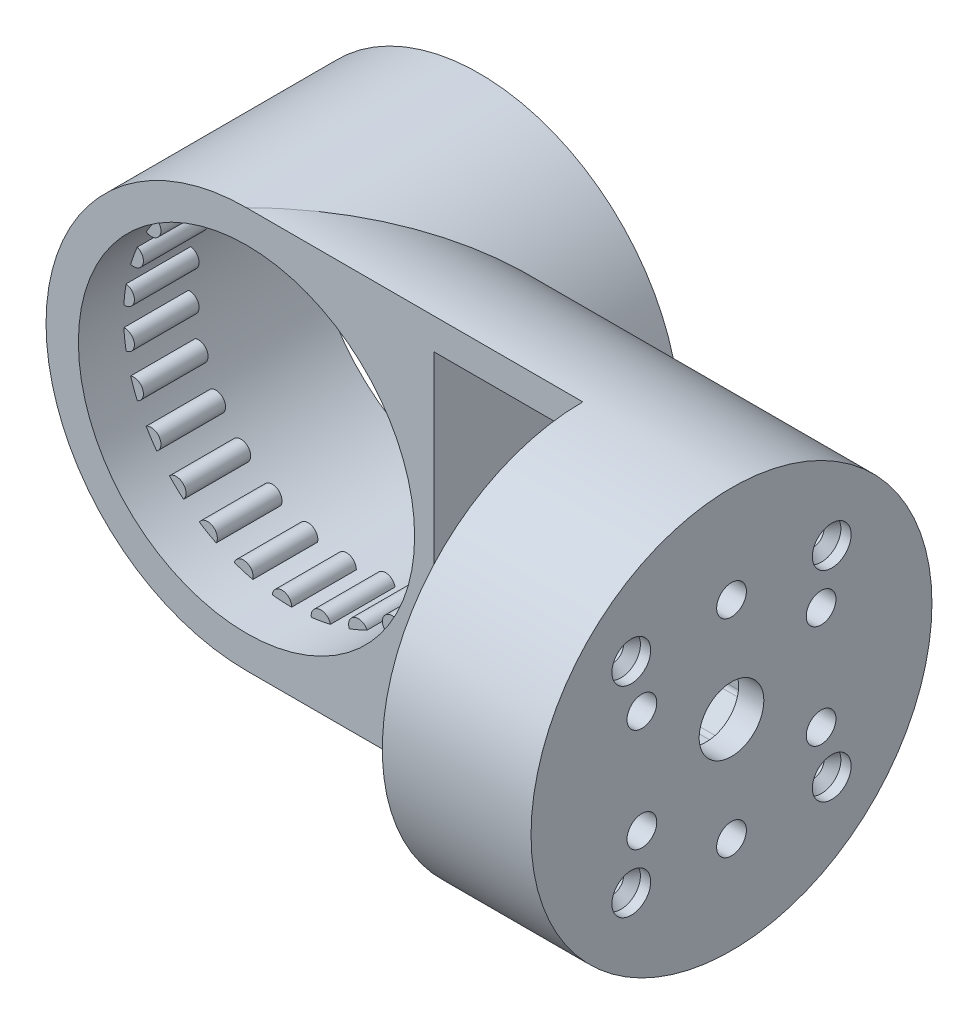
from build123d import *
from build123d.topology import SkipClean

# Parameters (mm, degrees)
SKETCH3_R                = 31
SKETCH3_R_2              = 26
BOSS_EXTRUDE1_DEPTH      = 7
SKETCH4_R                = 31
SKETCH4_R_2              = 26
BOSS_EXTRUDE2_DEPTH      = 10
SKETCH5_R                = 1.5
BOSS_EXTRUDE3_DEPTH      = 10
SKETCH7_R                = 31
SKETCH7_R_2              = 26
BOSS_EXTRUDE4_DEPTH      = 7
BOSS_EXTRUDE5_START      = 12
SKETCH33_R               = 31
SKETCH33_R_2             = 26
BOSS_EXTRUDE5_DEPTH      = 12
BOSS_EXTRUDE6_REACH      = 114.427
BOSS_EXTRUDE6_END_RADIUS = 31
BOSS_EXTRUDE7_DEPTH      = 23
CUT_EXTRUDE1_DEPTH       = 23
CUT_EXTRUDE2_START       = 23
CUT_EXTRUDE2_DEPTH       = 23
SKETCH42_R               = 31
BOSS_EXTRUDE8_DEPTH      = 6
SKETCH40_R               = 11
CUT_EXTRUDE3_DEPTH       = 2.1
CUT_EXTRUDE4_REACH       = 124.087
SKETCH39_R               = 5
SKETCH39_R_2             = 2.3
SKETCH39_R_3             = 3
CIRPATTERN1_COUNT        = 4


with BuildPart() as part:
    # Sketch3 → Boss-Extrude1 (new body)
    with BuildSketch(Plane.XY.offset(-2.959079422)):
        Circle(SKETCH3_R)
        Circle(SKETCH3_R_2, mode=Mode.SUBTRACT)
    extrude(amount=BOSS_EXTRUDE1_DEPTH)

    # Sketch4 → Boss-Extrude2 (add)
    with BuildSketch(Plane.XY.offset(4.040920578)):
        Circle(SKETCH4_R)
        Circle(SKETCH4_R_2, mode=Mode.SUBTRACT)
    extrude(amount=BOSS_EXTRUDE2_DEPTH)

    # Sketch5 → Boss-Extrude3 (add)
    with BuildSketch(Plane.XY.offset(4.051320578)):
        with Locations((26, 0)):
            Circle(SKETCH5_R)
        with Locations((25.299166635, -5.996012639)):
            Circle(SKETCH5_R)
        with Locations((23.234448648, -11.668778685)):
            Circle(SKETCH5_R)
        with Locations((19.917155521, -16.712477852)):
            Circle(SKETCH5_R)
        with Locations((15.526123384, -20.855203012)):
            Circle(SKETCH5_R)
        with Locations((10.298073917, -23.873618779)):
            Circle(SKETCH5_R)
        with Locations((4.514852619, -25.605001578)):
            Circle(SKETCH5_R)
        with Locations((-1.511765552, -25.956012115)):
            Circle(SKETCH5_R)
        with Locations((-7.45688405, -24.90772732)):
            Circle(SKETCH5_R)
        with Locations((-13, -22.516660498)):
            Circle(SKETCH5_R)
        with Locations((-17.842282585, -18.911714681)):
            Circle(SKETCH5_R)
        with Locations((-21.722683097, -14.28723343)):
            Circle(SKETCH5_R)
        with Locations((-24.43200814, -8.892523726)):
            Circle(SKETCH5_R)
        with Locations((-25.824197301, -3.018415767)):
            Circle(SKETCH5_R)
        with Locations((-25.824197301, 3.018415767)):
            Circle(SKETCH5_R)
        with Locations((-24.43200814, 8.892523726)):
            Circle(SKETCH5_R)
        with Locations((-21.722683097, 14.28723343)):
            Circle(SKETCH5_R)
        with Locations((-17.842282585, 18.911714681)):
            Circle(SKETCH5_R)
        with Locations((-13, 22.516660498)):
            Circle(SKETCH5_R)
        with Locations((-7.45688405, 24.90772732)):
            Circle(SKETCH5_R)
        with Locations((-1.511765552, 25.956012115)):
            Circle(SKETCH5_R)
        with Locations((4.514852619, 25.605001578)):
            Circle(SKETCH5_R)
        with Locations((10.298073917, 23.873618779)):
            Circle(SKETCH5_R)
        with Locations((15.526123384, 20.855203012)):
            Circle(SKETCH5_R)
        with Locations((19.917155521, 16.712477852)):
            Circle(SKETCH5_R)
        with Locations((23.234448648, 11.668778685)):
            Circle(SKETCH5_R)
        with Locations((25.299166635, 5.996012639)):
            Circle(SKETCH5_R)
    extrude(amount=BOSS_EXTRUDE3_DEPTH)

    # Sketch7 → Boss-Extrude4 (add)
    with BuildSketch(Plane.XY.offset(14.040920578)):
        Circle(SKETCH7_R)
        Circle(SKETCH7_R_2, mode=Mode.SUBTRACT)
    extrude(amount=BOSS_EXTRUDE4_DEPTH)

    # Sketch33 → Boss-Extrude5 (add)
    with SkipClean():  # the faces are left unmerged after this step: merging them gives an invalid solid
        with BuildSketch(Plane(origin=(0, 0, -2.959079422), x_dir=(-1, 0, 0), z_dir=(0, 0, -1)).offset(BOSS_EXTRUDE5_START)):
            Circle(SKETCH33_R)
            Circle(SKETCH33_R_2, mode=Mode.SUBTRACT)
        extrude(amount=-BOSS_EXTRUDE5_DEPTH)

    # Boss-Extrude6: up to this cylinder (the profile starts outside it)
    with SkipClean():  # the faces are left unmerged after this step: merging them gives an invalid solid
        boss_extrude6_end = Plane(origin=(0, 0, 7.884112), z_dir=(0, 0, -1)) * Cylinder(BOSS_EXTRUDE6_END_RADIUS, 291.854, mode=Mode.PRIVATE)
        # Sketch34 → Boss-Extrude6 (add, up to the surface)
        with BuildSketch(Plane(origin=(75, 0, 0), x_dir=(0, 0, -1), z_dir=(1, 0, 0)), mode=Mode.PRIVATE) as boss_extrude6_sk1:
            with BuildLine():
                Line((-21.040920578, 31), (-21.040920578, -31))
                ThreePointArc((-21.040920578, -31), (9.959079422, 0), (-21.040920578, 31))
            make_face()
        boss_extrude6_tool1 = extrude(boss_extrude6_sk1.sketch, amount=-BOSS_EXTRUDE6_REACH, mode=Mode.PRIVATE) - boss_extrude6_end
        add(boss_extrude6_tool1.solids().sort_by_distance((75, 0, 7.884112))[0])

    # Sketch35 → Boss-Extrude7 (add)
    with SkipClean():  # the faces are left unmerged after this step: merging them gives an invalid solid
        with BuildSketch(Plane(origin=(75, 0, 0), x_dir=(0, 0, -1), z_dir=(1, 0, 0))):
            with BuildLine():
                Line((-21.040920578, 31), (-21.040920578, -31))
                ThreePointArc((-21.040920578, -31), (-52.040920578, 0), (-21.040920578, 31))
            make_face()
        extrude(amount=-BOSS_EXTRUDE7_DEPTH)
    add(part.part.scale(1), mode=Mode.REPLACE)  # the faces are merged on a copy

    # Sketch37 → Cut-Extrude1 (cut)
    with BuildSketch(Plane.ZY.offset(-52)):
        with BuildLine():
            Line((37.789247723, 21.2058), (36.42773462, 21.2058))
            ThreePointArc((36.42773462, 21.2058), (21.040920578, 26.2), (5.654106536, 21.2058))
            Line((5.654106536, 21.2058), (4.292593433, 21.2058))
            ThreePointArc((4.292593433, 21.2058), (3.906159703, 21.128933552), (3.578557006, 20.910036428))
            Line((3.578557006, 20.910036428), (0.13088415, 17.462363572))
            ThreePointArc((0.13088415, 17.462363572), (-0.088012974, 17.134760875), (-0.164879422, 16.748327145))
            Line((-0.164879422, 16.748327145), (-0.164879422, 15.386814042))
            ThreePointArc((-0.164879422, 15.386814042), (-5.159079422, 0), (-0.164879422, -15.386814042))
            Line((-0.164879422, -15.386814042), (-0.164879422, -16.748327145))
            ThreePointArc((-0.164879422, -16.748327145), (-0.088012974, -17.134760875), (0.13088415, -17.462363572))
            Line((0.13088415, -17.462363572), (3.578557006, -20.910036428))
            ThreePointArc((3.578557006, -20.910036428), (3.906159703, -21.128933552), (4.292593433, -21.2058))
            Line((4.292593433, -21.2058), (5.654106536, -21.2058))
            ThreePointArc((5.654106536, -21.2058), (21.040920578, -26.2), (36.42773462, -21.2058))
            Line((36.42773462, -21.2058), (37.789247723, -21.2058))
            ThreePointArc((37.789247723, -21.2058), (38.175681453, -21.128933552), (38.50328415, -20.910036428))
            Line((38.50328415, -20.910036428), (41.950957006, -17.462363572))
            ThreePointArc((41.950957006, -17.462363572), (42.16985413, -17.134760875), (42.246720578, -16.748327145))
            Line((42.246720578, -16.748327145), (42.246720578, -15.386814042))
            ThreePointArc((42.246720578, -15.386814042), (47.240920578, 0), (42.246720578, 15.386814042))
            Line((42.246720578, 15.386814042), (42.246720578, 16.748327145))
            ThreePointArc((42.246720578, 16.748327145), (42.16985413, 17.134760875), (41.950957006, 17.462363572))
            Line((41.950957006, 17.462363572), (38.50328415, 20.910036428))
            ThreePointArc((38.50328415, 20.910036428), (38.175681453, 21.128933552), (37.789247723, 21.2058))
        make_face()
    extrude(amount=-CUT_EXTRUDE1_DEPTH, mode=Mode.SUBTRACT)

    # Sketch38 → Cut-Extrude2 (cut)
    with BuildSketch(Plane.ZY.offset(-52).offset(CUT_EXTRUDE2_START)):
        with BuildLine():
            Line((21.040920578, 26.2), (21.040920578, -26.2))
            ThreePointArc((21.040920578, -26.2), (12.952408972, -24.920192214), (5.654106536, -21.2058))
            Line((5.654106536, -21.2058), (4.292593433, -21.2058))
            ThreePointArc((4.292593433, -21.2058), (3.906159703, -21.128933552), (3.578557006, -20.910036428))
            Line((3.578557006, -20.910036428), (0.13088415, -17.462363572))
            ThreePointArc((0.13088415, -17.462363572), (-0.088012974, -17.134760875), (-0.164879422, -16.748327145))
            Line((-0.164879422, -16.748327145), (-0.164879422, -15.386814042))
            ThreePointArc((-0.164879422, -15.386814042), (-5.159079422, 0), (-0.164879422, 15.386814042))
            Line((-0.164879422, 15.386814042), (-0.164879422, 16.748327145))
            ThreePointArc((-0.164879422, 16.748327145), (-0.088012974, 17.134760875), (0.13088415, 17.462363572))
            Line((0.13088415, 17.462363572), (3.578557006, 20.910036428))
            ThreePointArc((3.578557006, 20.910036428), (3.906159703, 21.128933552), (4.292593433, 21.2058))
            Line((4.292593433, 21.2058), (5.654106536, 21.2058))
            ThreePointArc((5.654106536, 21.2058), (12.952408972, 24.920192214), (21.040920578, 26.2))
        make_face()
    extrude(amount=-CUT_EXTRUDE2_DEPTH, mode=Mode.SUBTRACT)

    # Sketch42 → Boss-Extrude8 (add)
    with BuildSketch(Plane(origin=(75, 0, 0), x_dir=(0, 0, -1), z_dir=(1, 0, 0))):
        with Locations((-21.040920578, 0)):
            Circle(SKETCH42_R)
    extrude(amount=-BOSS_EXTRUDE8_DEPTH)

    # Sketch40 → Cut-Extrude3 (cut)
    with BuildSketch(Plane.ZY.offset(-69)):
        with Locations((21.040920578, 0)):
            Circle(SKETCH40_R)
    extrude(amount=-CUT_EXTRUDE3_DEPTH, mode=Mode.SUBTRACT)

    # Sketch39 → Cut-Extrude4 (cut, up to next)
    with BuildSketch(Plane(origin=(75, 0, 0), x_dir=(0, 0, -1), z_dir=(1, 0, 0)), mode=Mode.PRIVATE) as cut_extrude4_sk1:
        with Locations((-21.040920578, 0)):
            Circle(SKETCH39_R)
    cut_extrude4_tool1 = extrude(cut_extrude4_sk1.sketch, amount=-CUT_EXTRUDE4_REACH, mode=Mode.PRIVATE) & part.part
    # Sketch39 → Cut-Extrude4 (cut, up to next)
    with BuildSketch(Plane(origin=(75, 0, 0), x_dir=(0, 0, -1), z_dir=(1, 0, 0)), mode=Mode.PRIVATE) as cut_extrude4_sk2:
        with Locations((-34.897327039, -8)):
            Circle(SKETCH39_R_2)
    cut_extrude4_tool2 = extrude(cut_extrude4_sk2.sketch, amount=-CUT_EXTRUDE4_REACH, mode=Mode.PRIVATE) & part.part
    # Sketch39 → Cut-Extrude4 (cut, up to next)
    with BuildSketch(Plane(origin=(75, 0, 0), x_dir=(0, 0, -1), z_dir=(1, 0, 0)), mode=Mode.PRIVATE) as cut_extrude4_sk3:
        with Locations((-5.540921156, 15.5)):
            Circle(SKETCH39_R_3)
    cut_extrude4_tool3 = extrude(cut_extrude4_sk3.sketch, amount=-CUT_EXTRUDE4_REACH, mode=Mode.PRIVATE) & part.part
    # Sketch39 → Cut-Extrude4 (cut, up to next)
    with BuildSketch(Plane(origin=(75, 0, 0), x_dir=(0, 0, -1), z_dir=(1, 0, 0)), mode=Mode.PRIVATE) as cut_extrude4_sk4:
        with Locations((-21.040920578, -16)):
            Circle(SKETCH39_R_2)
    cut_extrude4_tool4 = extrude(cut_extrude4_sk4.sketch, amount=-CUT_EXTRUDE4_REACH, mode=Mode.PRIVATE) & part.part
    # Sketch39 → Cut-Extrude4 (cut, up to next)
    with BuildSketch(Plane(origin=(75, 0, 0), x_dir=(0, 0, -1), z_dir=(1, 0, 0)), mode=Mode.PRIVATE) as cut_extrude4_sk5:
        with Locations((-7.184514117, -8)):
            Circle(SKETCH39_R_2)
    cut_extrude4_tool5 = extrude(cut_extrude4_sk5.sketch, amount=-CUT_EXTRUDE4_REACH, mode=Mode.PRIVATE) & part.part
    # Sketch39 → Cut-Extrude4 (cut, up to next)
    with BuildSketch(Plane(origin=(75, 0, 0), x_dir=(0, 0, -1), z_dir=(1, 0, 0)), mode=Mode.PRIVATE) as cut_extrude4_sk6:
        with Locations((-7.184514117, 8)):
            Circle(SKETCH39_R_2)
    cut_extrude4_tool6 = extrude(cut_extrude4_sk6.sketch, amount=-CUT_EXTRUDE4_REACH, mode=Mode.PRIVATE) & part.part
    # Sketch39 → Cut-Extrude4 (cut, up to next)
    with BuildSketch(Plane(origin=(75, 0, 0), x_dir=(0, 0, -1), z_dir=(1, 0, 0)), mode=Mode.PRIVATE) as cut_extrude4_sk7:
        with Locations((-21.040920578, 16)):
            Circle(SKETCH39_R_2)
    cut_extrude4_tool7 = extrude(cut_extrude4_sk7.sketch, amount=-CUT_EXTRUDE4_REACH, mode=Mode.PRIVATE) & part.part
    # Sketch39 → Cut-Extrude4 (cut, up to next)
    with BuildSketch(Plane(origin=(75, 0, 0), x_dir=(0, 0, -1), z_dir=(1, 0, 0)), mode=Mode.PRIVATE) as cut_extrude4_sk8:
        with Locations((-34.897327039, 8)):
            Circle(SKETCH39_R_2)
    cut_extrude4_tool8 = extrude(cut_extrude4_sk8.sketch, amount=-CUT_EXTRUDE4_REACH, mode=Mode.PRIVATE) & part.part
    # Sketch39 → Cut-Extrude4 (cut, up to next)
    with BuildSketch(Plane(origin=(75, 0, 0), x_dir=(0, 0, -1), z_dir=(1, 0, 0)), mode=Mode.PRIVATE) as cut_extrude4_sk9:
        with Locations((-5.540920578, -15.499999422)):
            Circle(SKETCH39_R_3)
    cut_extrude4_tool9 = extrude(cut_extrude4_sk9.sketch, amount=-CUT_EXTRUDE4_REACH, mode=Mode.PRIVATE) & part.part
    # Sketch39 → Cut-Extrude4 (cut, up to next)
    with BuildSketch(Plane(origin=(75, 0, 0), x_dir=(0, 0, -1), z_dir=(1, 0, 0)), mode=Mode.PRIVATE) as cut_extrude4_sk10:
        with Locations((-36.54092, -15.5)):
            Circle(SKETCH39_R_3)
    cut_extrude4_tool10 = extrude(cut_extrude4_sk10.sketch, amount=-CUT_EXTRUDE4_REACH, mode=Mode.PRIVATE) & part.part
    # Sketch39 → Cut-Extrude4 (cut, up to next)
    with BuildSketch(Plane(origin=(75, 0, 0), x_dir=(0, 0, -1), z_dir=(1, 0, 0)), mode=Mode.PRIVATE) as cut_extrude4_sk11:
        with Locations((-36.540920578, 15.499999422)):
            Circle(SKETCH39_R_3)
    cut_extrude4_tool11 = extrude(cut_extrude4_sk11.sketch, amount=-CUT_EXTRUDE4_REACH, mode=Mode.PRIVATE) & part.part
    add(cut_extrude4_tool1.solids().sort_by_distance((75, 0, 21.040921))[0], mode=Mode.SUBTRACT)
    add(cut_extrude4_tool2.solids().sort_by_distance((75, -8, 34.897327))[0], mode=Mode.SUBTRACT)
    add(cut_extrude4_tool3.solids().sort_by_distance((75, 15.5, 5.540921))[0], mode=Mode.SUBTRACT)
    add(cut_extrude4_tool4.solids().sort_by_distance((75, -16, 21.040921))[0], mode=Mode.SUBTRACT)
    add(cut_extrude4_tool5.solids().sort_by_distance((75, -8, 7.184514))[0], mode=Mode.SUBTRACT)
    add(cut_extrude4_tool6.solids().sort_by_distance((75, 8, 7.184514))[0], mode=Mode.SUBTRACT)
    add(cut_extrude4_tool7.solids().sort_by_distance((75, 16, 21.040921))[0], mode=Mode.SUBTRACT)
    add(cut_extrude4_tool8.solids().sort_by_distance((75, 8, 34.897327))[0], mode=Mode.SUBTRACT)
    add(cut_extrude4_tool9.solids().sort_by_distance((75, -15.499999, 5.540921))[0], mode=Mode.SUBTRACT)
    add(cut_extrude4_tool10.solids().sort_by_distance((75, -15.5, 36.54092))[0], mode=Mode.SUBTRACT)
    add(cut_extrude4_tool11.solids().sort_by_distance((75, 15.499999, 36.540921))[0], mode=Mode.SUBTRACT)

    # Sketch41 → Revolve1 (revolve)
    with SkipClean():  # the faces are left unmerged after this step: merging them gives an invalid solid
        with BuildSketch(Plane(origin=(0, 0, 36.54092), x_dir=(-1, 0, 0), z_dir=(0, 0, -1))):
            Polygon((-72.115, 17.199999422), (-73.415, 18.5), (-69, 18.5), (-69, 17.199999422), align=None)
        revolve1 = revolve(axis=Axis((69, 15.499999422, 36.540920578), (1, 0, 0)))

    # CirPattern1: Revolve1 ×4 about axis
    with SkipClean():  # the faces are left unmerged after this step: merging them gives an invalid solid
        cirpattern1_axis = Axis((75, 0, 21.040920578), (1, 0, 0))
        for i in range(1, CIRPATTERN1_COUNT):
            add(revolve1.rotate(cirpattern1_axis, i * 360 / CIRPATTERN1_COUNT))


solid = part.part
